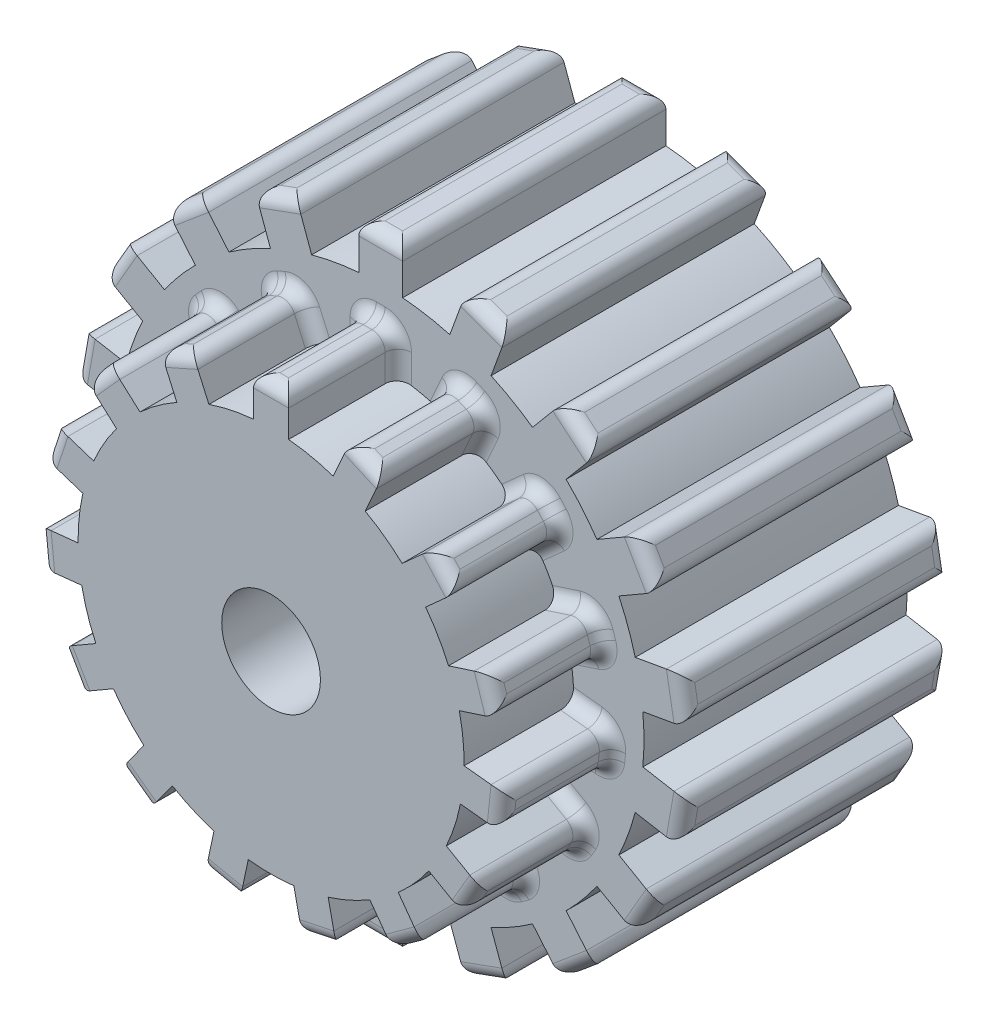
from build123d import *

# Parameters (mm, degrees)
SKETCH2_R                = 60
BOSS_EXTRUDE1_DEPTH      = 60
SKETCH3_W                = 10
SKETCH3_H                = 10.47851478
BOSS_EXTRUDE2_DEPTH      = 60
FILLET2_R                = 3
CIRPATTERN1_COUNT        = 18
FILLET2_OF_CIRPATTERN1_R = 3
SKETCH4_R                = 10
CUT_EXTRUDE1_DEPTH       = 60
SKETCH5_R                = 44
BOSS_EXTRUDE3_DEPTH      = 25
SKETCH6_W                = 8
SKETCH6_H                = 10.044359629
BOSS_EXTRUDE4_DEPTH      = 25
CUT_EXTRUDE2_START       = -90
SKETCH7_R                = 10
CUT_EXTRUDE2_DEPTH       = 90
FILLET3_R                = 3
CIRPATTERN2_COUNT        = 15
FILLET3_OF_CIRPATTERN2_R = 3
SKETCH8_R                = 11.25
CUT_EXTRUDE3_DEPTH       = 85
SCALE1_SCALE             = 0.2


with BuildPart() as part:
    # Sketch2 → Boss-Extrude1 (new body)
    with BuildSketch(Plane.XY):
        Circle(SKETCH2_R)
    extrude(amount=BOSS_EXTRUDE1_DEPTH)

    # Sketch3 → Boss-Extrude2 (add)
    with BuildSketch(Plane.XY.offset(60)):
        with Locations((0, 64.76074261)):
            Rectangle(SKETCH3_W, SKETCH3_H)
    boss_extrude2 = extrude(amount=-BOSS_EXTRUDE2_DEPTH)

    # Fillet2
    fillet2_edges = [part.edges().sort_by_distance(p)[0] for p in [
        (5, 70, 30),
        (0, 70, 0),
        (-5, 70, 30),
        (0, 70, 60),
    ]]
    fillet(fillet2_edges, radius=FILLET2_R)

    # CirPattern1: Boss-Extrude2 ×18 about axis
    cirpattern1_axis = Axis((0, 0, 0), (0, 0, 1))
    for i in range(1, CIRPATTERN1_COUNT):
        add(boss_extrude2.rotate(cirpattern1_axis, i * 360 / CIRPATTERN1_COUNT))

    # Fillet2 of CirPattern1
    fillet2_of_cirpattern1_edges = [part.edges().sort_by_distance(p)[0] for p in [
        (-19.242946929, 67.488584172, 30),
        (-23.941410033, 65.778483455, 0),
        (-28.639873137, 64.068382738, 30),
        (-23.941410033, 65.778483455, 60),
        (-41.164910462, 56.837049067, 30),
        (-44.995132678, 53.623111018, 0),
        (-48.825354894, 50.40917297, 30),
        (-44.995132678, 53.623111018, 60),
        (-58.121778265, 39.330127019, 30),
        (-60.621778265, 35, 0),
        (-63.121778265, 30.669872981, 30),
        (-60.621778265, 35, 60),
        (-68.068301823, 17.079411202, 30),
        (-68.936542711, 12.155372437, 0),
        (-69.804783599, 7.231333672, 30),
        (-68.936542711, 12.155372437, 60),
        (-69.804783599, -7.231333672, 30),
        (-68.936542711, -12.155372437, 0),
        (-68.068301823, -17.079411202, 30),
        (-68.936542711, -12.155372437, 60),
        (-63.121778265, -30.669872981, 30),
        (-60.621778265, -35, 0),
        (-58.121778265, -39.330127019, 30),
        (-60.621778265, -35, 60),
        (-48.825354894, -50.40917297, 30),
        (-44.995132678, -53.623111018, 0),
        (-41.164910462, -56.837049067, 30),
        (-44.995132678, -53.623111018, 60),
        (-28.639873137, -64.068382738, 30),
        (-23.941410033, -65.778483455, 0),
        (-19.242946929, -67.488584172, 30),
        (-23.941410033, -65.778483455, 60),
        (-5, -70, 30),
        (0, -70, 0),
        (5, -70, 30),
        (0, -70, 60),
        (19.242946929, -67.488584172, 30),
        (23.941410033, -65.778483455, 0),
        (28.639873137, -64.068382738, 30),
        (23.941410033, -65.778483455, 60),
        (41.164910462, -56.837049067, 30),
        (44.995132678, -53.623111018, 0),
        (48.825354894, -50.40917297, 30),
        (44.995132678, -53.623111018, 60),
        (58.121778265, -39.330127019, 30),
        (60.621778265, -35, 0),
        (63.121778265, -30.669872981, 30),
        (60.621778265, -35, 60),
        (68.068301823, -17.079411202, 30),
        (68.936542711, -12.155372437, 0),
        (69.804783599, -7.231333672, 30),
        (68.936542711, -12.155372437, 60),
        (69.804783599, 7.231333672, 30),
        (68.936542711, 12.155372437, 0),
        (68.068301823, 17.079411202, 30),
        (68.936542711, 12.155372437, 60),
        (63.121778265, 30.669872981, 30),
        (60.621778265, 35, 0),
        (58.121778265, 39.330127019, 30),
        (60.621778265, 35, 60),
        (48.825354894, 50.40917297, 30),
        (44.995132678, 53.623111018, 0),
        (41.164910462, 56.837049067, 30),
        (44.995132678, 53.623111018, 60),
        (28.639873137, 64.068382738, 30),
        (23.941410033, 65.778483455, 0),
        (19.242946929, 67.488584172, 30),
        (23.941410033, 65.778483455, 60),
    ]]
    fillet(fillet2_of_cirpattern1_edges, radius=FILLET2_OF_CIRPATTERN1_R)

    # Sketch4 → Cut-Extrude1 (cut)
    with BuildSketch(Plane.XY.offset(60)):
        Circle(SKETCH4_R)
    extrude(amount=-CUT_EXTRUDE1_DEPTH, mode=Mode.SUBTRACT)

    # Sketch5 → Boss-Extrude3 (add)
    with BuildSketch(Plane.XY.offset(60)):
        Circle(SKETCH5_R)
    extrude(amount=BOSS_EXTRUDE3_DEPTH)

    # Sketch6 → Boss-Extrude4 (add)
    with BuildSketch(Plane.XY.offset(85)):
        with Locations((0, 47.977820186)):
            Rectangle(SKETCH6_W, SKETCH6_H)
    boss_extrude4 = extrude(amount=-BOSS_EXTRUDE4_DEPTH)

    # Sketch7 → Cut-Extrude2 (cut)
    with BuildSketch(Plane(origin=(0, 0, 0), x_dir=(-1, 0, 0), z_dir=(0, 0, -1)).offset(CUT_EXTRUDE2_START)):
        with Locations(Location((0, 0, 0), (0, 0, 180))):
            Circle(SKETCH7_R)
    extrude(amount=CUT_EXTRUDE2_DEPTH, mode=Mode.SUBTRACT)

    # Fillet3
    fillet3_edges = [part.edges().sort_by_distance(p)[0] for p in [
        (-4, 48.4089023, 60),
        (4, 48.4089023, 60),
        (4, 53, 72.5),
        (0, 53, 60),
        (-4, 53, 72.5),
        (0, 53, 85),
    ]]
    fillet(fillet3_edges, radius=FILLET3_R)

    # CirPattern2: Boss-Extrude4 ×15 about axis
    cirpattern2_axis = Axis((0, 0, 0), (0, 0, 1))
    for i in range(1, CIRPATTERN2_COUNT):
        add(boss_extrude4.rotate(cirpattern2_axis, i * 360 / CIRPATTERN2_COUNT))

    # Fillet3 of CirPattern2
    fillet3_of_cirpattern2_edges = [part.edges().sort_by_distance(p)[0] for p in [
        (-23.343856247, 42.596786234, 60),
        (-16.035492586, 45.850679378, 60),
        (-17.902860252, 50.044855827, 72.5),
        (-21.557042083, 48.417909255, 60),
        (-25.211223914, 46.790962683, 72.5),
        (-21.557042083, 48.417909255, 85),
        (-38.651347677, 29.419298847, 60),
        (-33.298302826, 35.364457451, 60),
        (-36.710153325, 38.436501439, 72.5),
        (-39.38667575, 35.463922137, 60),
        (-42.063198176, 32.491342835, 72.5),
        (-39.38667575, 35.463922137, 85),
        (-47.275669957, 11.154947425, 60),
        (-44.803534002, 18.763399555, 60),
        (-49.169927386, 20.182126767, 72.5),
        (-50.405995364, 16.377900702, 60),
        (-51.642063341, 12.573674637, 72.5),
        (-50.405995364, 16.377900702, 85),
        (-47.725599415, -9.038195747, 60),
        (-48.561827121, -1.082020584, 60),
        (-53.127774308, -1.561920972, 72.5),
        (-52.709660455, -5.540008553, 60),
        (-52.291546601, -9.518096135, 72.5),
        (-52.709660455, -5.540008553, 85),
        (-39.923339161, -27.668552765, 60),
        (-43.923339161, -20.740349535, 60),
        (-47.899346401, -23.035898385, 72.5),
        (-45.899346401, -26.5, 60),
        (-43.899346401, -29.964101615, 72.5),
        (-45.899346401, -26.5, 85),
        (-25.217970874, -41.514765649, 60),
        (-31.690106829, -36.812483631, 60),
        (-34.388686349, -40.526759693, 72.5),
        (-31.152618372, -42.877900702, 60),
        (-27.916550394, -45.229041711, 72.5),
        (-31.152618372, -42.877900702, 85),
        (-6.152186325, -48.182698402, 60),
        (-13.977367131, -46.519404876, 60),
        (-14.931910016, -51.010176076, 72.5),
        (-11.019319613, -51.841822839, 60),
        (-7.10672921, -52.673469602, 72.5),
        (-11.019319613, -51.841822839, 85),
        (13.977367131, -46.519404876, 60),
        (6.152186325, -48.182698402, 60),
        (7.10672921, -52.673469602, 72.5),
        (11.019319613, -51.841822839, 60),
        (14.931910016, -51.010176076, 72.5),
        (11.019319613, -51.841822839, 85),
        (31.690106829, -36.812483631, 60),
        (25.217970874, -41.514765649, 60),
        (27.916550394, -45.229041711, 72.5),
        (31.152618372, -42.877900702, 60),
        (34.388686349, -40.526759693, 72.5),
        (31.152618372, -42.877900702, 85),
        (43.923339161, -20.740349535, 60),
        (39.923339161, -27.668552765, 60),
        (43.899346401, -29.964101615, 72.5),
        (45.899346401, -26.5, 60),
        (47.899346401, -23.035898385, 72.5),
        (45.899346401, -26.5, 85),
        (48.561827121, -1.082020584, 60),
        (47.725599415, -9.038195747, 60),
        (52.291546601, -9.518096135, 72.5),
        (52.709660455, -5.540008553, 60),
        (53.127774308, -1.561920972, 72.5),
        (52.709660455, -5.540008553, 85),
        (44.803534002, 18.763399555, 60),
        (47.275669957, 11.154947425, 60),
        (51.642063341, 12.573674637, 72.5),
        (50.405995364, 16.377900702, 60),
        (49.169927386, 20.182126767, 72.5),
        (50.405995364, 16.377900702, 85),
        (33.298302826, 35.364457451, 60),
        (38.651347677, 29.419298847, 60),
        (42.063198176, 32.491342835, 72.5),
        (39.38667575, 35.463922137, 60),
        (36.710153325, 38.436501439, 72.5),
        (39.38667575, 35.463922137, 85),
        (16.035492586, 45.850679378, 60),
        (23.343856247, 42.596786234, 60),
        (25.211223914, 46.790962683, 72.5),
        (21.557042083, 48.417909255, 60),
        (17.902860252, 50.044855827, 72.5),
        (21.557042083, 48.417909255, 85),
    ]]
    fillet(fillet3_of_cirpattern2_edges, radius=FILLET3_OF_CIRPATTERN2_R)

    # Sketch8 → Cut-Extrude3 (cut)
    with BuildSketch(Plane(origin=(0, 0, 0), x_dir=(-1, 0, 0), z_dir=(0, 0, -1))):
        Circle(SKETCH8_R)
    extrude(amount=-CUT_EXTRUDE3_DEPTH, mode=Mode.SUBTRACT)


with BuildPart() as part_1:
    # Scale1: scaled about (-2e-08, -9e-09, 37.709081226)
    add(part.part.scale(SCALE1_SCALE).moved(Location((-1.6e-08, -7e-09, 30.167264981))))


solid = part_1.part
